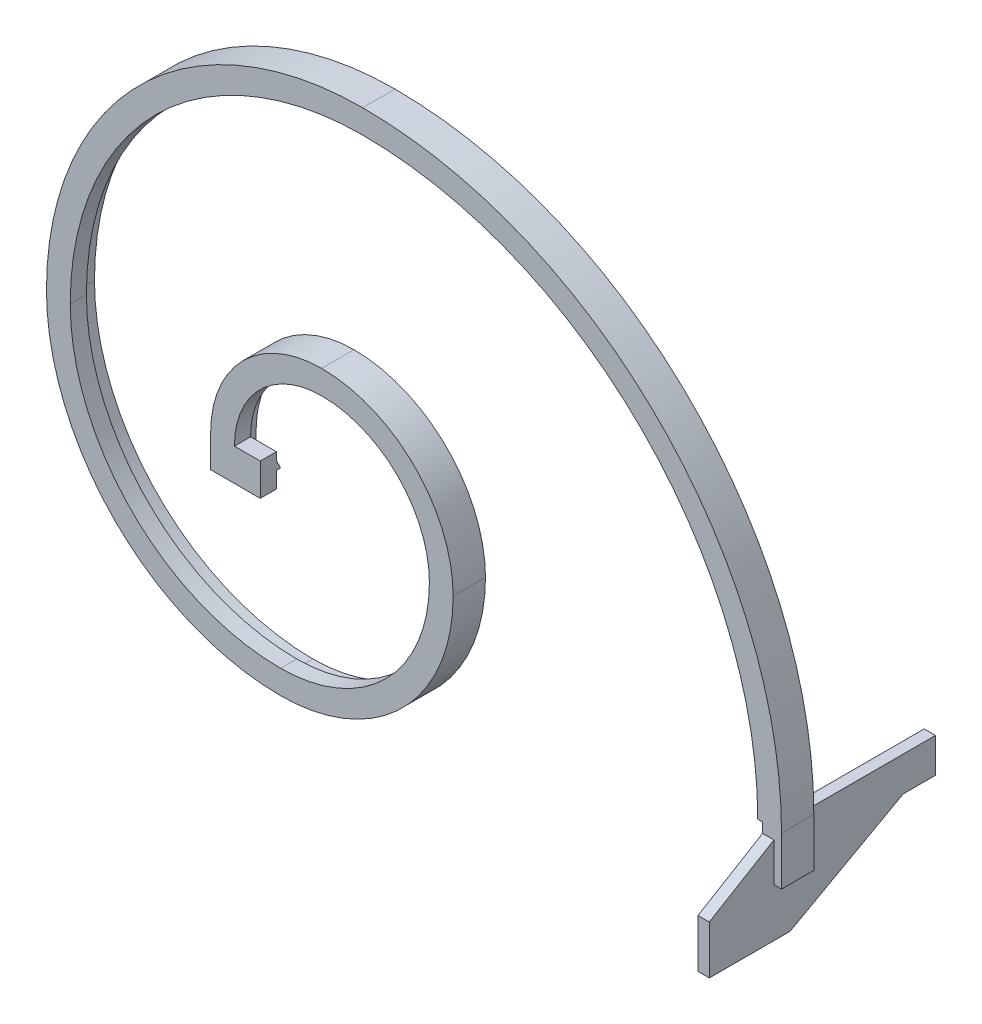
from build123d import *

# Parameters (mm, degrees)
EXTRUDE2_DEPTH     = 5
EXTRUDE3_DEPTH     = 5
EXTRUDE4_DEPTH     = 9.5
CUT_EXTRUDE1_DEPTH = 8
SKETCH7_W          = 5
SKETCH7_H          = 10
EXTRUDE5_DEPTH     = 8
SKETCH8_W          = 3.5
SKETCH8_H          = 10
EXTRUDE6_DEPTH     = 30
SKETCH9_W          = 3.5
SKETCH9_H          = 30
EXTRUDE7_DEPTH     = 20
SKETCH11_W         = 3.5
SKETCH11_H         = 30
EXTRUDE8_DEPTH     = 30
CUT_EXTRUDE2_DEPTH = 5
SKETCH12_W         = 3.5
SKETCH12_H         = 10.67873513
EXTRUDE9_DEPTH     = 10
EXTRUDE10_START    = -10
EXTRUDE10_DEPTH    = 10
CUT_EXTRUDE3_DEPTH = 15
CUT_EXTRUDE4_DEPTH = 5
CUT_EXTRUDE5_DEPTH = 1


with BuildPart() as part:
    # Sketch2 → Extrude2 (new body)
    with BuildSketch(Plane.XY):
        with BuildLine():
            Line((-28.4875, 0), (-28.4875, -10))
            Line((-28.4875, -10), (-31.9875, -10))
            Line((-31.9875, -10), (-31.9875, 0))
            ThreePointArc((-31.9875, 0), (-22.618578163, 22.618578163), (0, 31.9875))
            ThreePointArc((0, 31.9875), (27.108706224, 20.758706224), (38.3375, -6.35))
            ThreePointArc((38.3375, -6.35), (23.388962345, -42.438962345), (-12.7, -57.3875))
            ThreePointArc((-12.7, -57.3875), (-62.259346526, -36.859346526), (-82.7875, 12.7))
            ThreePointArc((-82.7875, 12.7), (-54.819858769, 80.219858769), (12.7, 108.1875))
            ThreePointArc((12.7, 108.1875), (102.670499071, 70.920499071), (139.9375, -19.05))
            Line((139.9375, -19.05), (136.4375, -19.05))
            ThreePointArc((136.4375, -19.05), (100.195625337, 68.445625337), (12.7, 104.6875))
            ThreePointArc((12.7, 104.6875), (-52.344985034, 77.744985034), (-79.2875, 12.7))
            ThreePointArc((-79.2875, 12.7), (-59.784472792, -34.384472792), (-12.7, -53.8875))
            ThreePointArc((-12.7, -53.8875), (20.914088611, -39.964088611), (34.8375, -6.35))
            ThreePointArc((34.8375, -6.35), (24.63383249, 18.28383249), (0, 28.4875))
            ThreePointArc((0, 28.4875), (-20.143704429, 20.143704429), (-28.4875, 0))
        make_face()
    extrude(amount=EXTRUDE2_DEPTH)

    # Sketch3 → Extrude3 (add)
    with BuildSketch(Plane.XY.offset(5)):
        with BuildLine():
            Line((-26.9875, 0), (-26.9875, -10))
            Line((-26.9875, -10), (-31.9875, -10))
            Line((-31.9875, -10), (-31.9875, 0))
            ThreePointArc((-31.9875, 0), (-22.618578163, 22.618578163), (0, 31.9875))
            ThreePointArc((0, 31.9875), (27.108706224, 20.758706224), (38.3375, -6.35))
            ThreePointArc((38.3375, -6.35), (23.388962345, -42.438962345), (-12.7, -57.3875))
            ThreePointArc((-12.7, -57.3875), (-62.259346526, -36.859346526), (-82.7875, 12.7))
            ThreePointArc((-82.7875, 12.7), (-54.819858769, 80.219858769), (12.7, 108.1875))
            ThreePointArc((12.7, 108.1875), (102.670499071, 70.920499071), (139.9375, -19.05))
            Line((139.9375, -19.05), (134.9375, -19.05))
            ThreePointArc((134.9375, -19.05), (99.134965165, 67.384965165), (12.7, 103.1875))
            ThreePointArc((12.7, 103.1875), (-51.284324863, 76.684324863), (-77.7875, 12.7))
            ThreePointArc((-77.7875, 12.7), (-58.72381262, -33.32381262), (-12.7, -52.3875))
            ThreePointArc((-12.7, -52.3875), (19.853428439, -38.903428439), (33.3375, -6.35))
            ThreePointArc((33.3375, -6.35), (23.573172318, 17.223172318), (0, 26.9875))
            ThreePointArc((0, 26.9875), (-19.083044257, 19.083044257), (-26.9875, 0))
        make_face()
    extrude(amount=EXTRUDE3_DEPTH)

    # Sketch4 → Extrude4 (add)
    with BuildSketch(Plane(origin=(-28.4875, 0, 0), x_dir=(0, 0, -1), z_dir=(1, 0, 0))):
        Polygon((-5, -2.4), (-1.2, -10), (-5, -10), align=None)
    extrude(amount=EXTRUDE4_DEPTH)

    # Sketch6 → Cut-Extrude1 (cut)
    with BuildSketch(Plane(origin=(-18.9875, 0, 0), x_dir=(0, 0, -1), z_dir=(1, 0, 0))):
        Polygon((-5, -5), (-3.7, -5), (-1.2, -10), (-5, -10), align=None)
    extrude(amount=-CUT_EXTRUDE1_DEPTH, mode=Mode.SUBTRACT)

    # Sketch7 → Extrude5 (add)
    with BuildSketch(Plane(origin=(-26.9875, 0, 0), x_dir=(0, 0, -1), z_dir=(1, 0, 0))):
        with Locations((-7.5, -5)):
            Rectangle(SKETCH7_W, SKETCH7_H)
    extrude(amount=EXTRUDE5_DEPTH)

    # Sketch8 → Extrude6 (add)
    with BuildSketch(Plane.XZ.offset(19.05)):
        with Locations((138.1875, 5)):
            Rectangle(SKETCH8_W, SKETCH8_H)
    extrude(amount=EXTRUDE6_DEPTH)

    # Sketch9 → Extrude7 (add)
    with BuildSketch(Plane.XY.offset(10)):
        with Locations((138.1875, -34.05)):
            Rectangle(SKETCH9_W, SKETCH9_H)
    extrude(amount=EXTRUDE7_DEPTH)

    # Sketch11 → Extrude8 (add)
    with BuildSketch(Plane(origin=(0, 0, 0), x_dir=(-1, 0, 0), z_dir=(0, 0, -1))):
        with Locations((-138.1875, -34.05)):
            Rectangle(SKETCH11_W, SKETCH11_H)
    extrude(amount=EXTRUDE8_DEPTH)

    # Sketch10 → Cut-Extrude2 (cut)
    with BuildSketch(Plane(origin=(139.9375, 0, 0), x_dir=(0, 0, -1), z_dir=(1, 0, 0))):
        Polygon((-5, -49.05), (30, -29.72873513), (30, -49.05), align=None)
        Polygon((-30, -34.05), (-30, -19.05), (-10, -19.05), (-10, -22.05), align=None)
    extrude(amount=-CUT_EXTRUDE2_DEPTH, mode=Mode.SUBTRACT)

    # Sketch12 → Extrude9 (add)
    with BuildSketch(Plane(origin=(0, 0, -30), x_dir=(-1, 0, 0), z_dir=(0, 0, -1))):
        with Locations((-138.1875, -24.389367565)):
            Rectangle(SKETCH12_W, SKETCH12_H)
    extrude(amount=EXTRUDE9_DEPTH)

    # Sketch14 → Extrude10 (add)
    with BuildSketch(Plane.XY.offset(10).offset(EXTRUDE10_START)):
        with BuildLine():
            Line((-34.3375, 0), (-34.3375, -10))
            Line((-34.3375, -10), (-31.9875, -10))
            Line((-31.9875, -10), (-31.9875, 0))
            ThreePointArc((-31.9875, 0), (-22.618578163, 22.618578163), (0, 31.9875))
            ThreePointArc((0, 31.9875), (27.108706224, 20.758706224), (38.3375, -6.35))
            ThreePointArc((38.3375, -6.35), (23.388962345, -42.438962345), (-12.7, -57.3875))
            ThreePointArc((-12.7, -57.3875), (-62.273683115, -36.845005789), (-82.787488266, 12.740555862))
            ThreePointArc((-82.787488266, 12.740555862), (-54.800329664, 80.224688864), (12.699982959, 108.172802388))
            ThreePointArc((12.699982959, 108.172802388), (102.670493046, 70.905807484), (139.9375, -19.064697612))
            Line((139.9375, -19.064697612), (139.9375, -34.05))
            Line((139.9375, -34.05), (142.2875, -34.05))
            Line((142.2875, -34.05), (142.2875, -19.064697612))
            ThreePointArc((142.2875, -19.064697612), (104.332193871, 72.567508531), (12.699982644, 110.522802388))
            ThreePointArc((12.699982644, 110.522802388), (-56.461549873, 81.886870388), (-85.137487873, 12.741915681))
            ThreePointArc((-85.137487873, 12.741915681), (-63.93586475, -38.506225887), (-12.7, -59.7375))
            ThreePointArc((-12.7, -59.7375), (25.050663281, -44.100663281), (40.6875, -6.35))
            ThreePointArc((40.6875, -6.35), (28.77040716, 22.42040716), (0, 34.3375))
            ThreePointArc((0, 34.3375), (-24.280279099, 24.280279099), (-34.3375, 0))
        make_face()
    extrude(amount=EXTRUDE10_DEPTH)

    # Sketch15 → Cut-Extrude3 (cut)
    with BuildSketch(Plane.ZY.offset(34.3375)):
        Polygon((0, 14), (0, -10), (1.2, -10), align=None)
    extrude(amount=-CUT_EXTRUDE3_DEPTH, mode=Mode.SUBTRACT)

    # Sketch16 → Cut-Extrude4 (cut)
    with BuildSketch(Plane(origin=(0, 0, 0), x_dir=(-1, 0, 0), z_dir=(0, 0, -1))):
        with BuildLine():
            Line((28.4875, 0), (29.4875, 0))
            ThreePointArc((29.4875, 0), (20.85081121, 20.85081121), (0, 29.4875))
            ThreePointArc((0, 29.4875), (-25.340939271, 18.990939271), (-35.8375, -6.35))
            ThreePointArc((-35.8375, -6.35), (-21.621195392, -40.671195392), (12.7, -54.8875))
            ThreePointArc((12.7, -54.8875), (60.491579573, -35.091579573), (80.2875, 12.7))
            ThreePointArc((80.2875, 12.7), (53.052091816, 78.452091816), (-12.7, 105.6875))
            ThreePointArc((-12.7, 105.6875), (-100.902732118, 69.152732118), (-137.4375, -19.05))
            Line((-137.4375, -19.05), (-136.4375, -34.05))
            Line((-136.4375, -34.05), (-136.4375, -19.05))
            ThreePointArc((-136.4375, -19.05), (-100.195625337, 68.445625337), (-12.7, 104.6875))
            ThreePointArc((-12.7, 104.6875), (52.344985034, 77.744985034), (79.2875, 12.7))
            ThreePointArc((79.2875, 12.7), (59.784472792, -34.384472792), (12.7, -53.8875))
            ThreePointArc((12.7, -53.8875), (-20.914088611, -39.964088611), (-34.8375, -6.35))
            ThreePointArc((-34.8375, -6.35), (-24.63383249, 18.28383249), (0, 28.4875))
            ThreePointArc((0, 28.4875), (20.143704429, 20.143704429), (28.4875, 0))
        make_face()
    extrude(amount=-CUT_EXTRUDE4_DEPTH, mode=Mode.SUBTRACT)

    # Sketch17 → Cut-Extrude5 (cut)
    with BuildSketch(Plane(origin=(-28.4875, 0, 0), x_dir=(0, 0, -1), z_dir=(1, 0, 0))):
        Polygon((-5, 0), (-5, -2.4), (-1.2, -10), (0, -10), (0, 0), align=None)
    extrude(amount=-CUT_EXTRUDE5_DEPTH, mode=Mode.SUBTRACT)


solid = part.part
